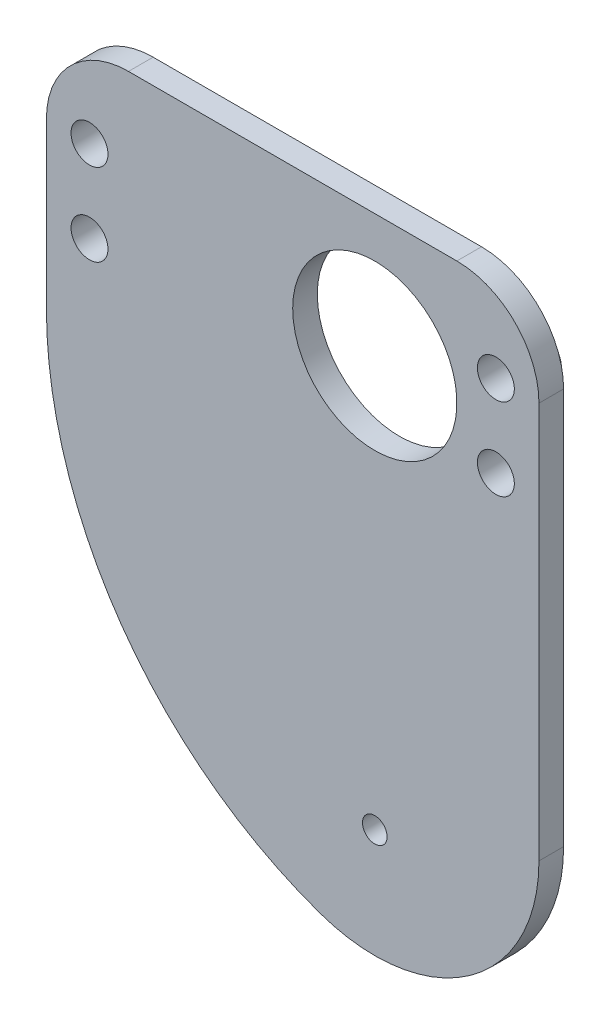
from build123d import *

# Parameters (mm, degrees)
SKETCH_3_R               = 3
EXTRUDE_6_DEPTH          = 2
EXTRUDE_6_2_DEPTH        = 2
EXTRUDE_6_3_DEPTH        = 2
EXTRUDE_6_4_DEPTH        = 2
CUT_EXTRUDE_2_DEPTH      = 10
CUT_EXTRUDE_2_DEPTH_BACK = 2
SKETCH_11_R              = 2.25
SKETCH_12_W              = 60
SKETCH_12_H              = 80
EXTRUDE_7_DEPTH          = 3
CUT_EXTRUDE_START        = -3
SKETCH_14_R              = 2.25
SKETCH_14_R_2            = 10
CUT_EXTRUDE_3_DEPTH      = 3
SKETCH_15_R              = 10
SKETCH_15_R_2            = 1.5
CUT_EXTRUDE_4_DEPTH      = 3
FILLET_2_R               = 50
FILLET_3_R               = 20
FILLET_4_R               = 10


with BuildPart() as part:
    # 草图3 → 凸台-拉伸6 (new body)
    with BuildSketch(Plane.XY):
        with Locations((60.266478541, 16.532501821)):
            Circle(SKETCH_3_R)
    extrude(amount=EXTRUDE_6_DEPTH)


with BuildPart() as body_2:
    # 草图3 → Extrude 6 2 (new body)
    with BuildSketch(Plane.XY):
        with Locations((60.266478541, 6.532501821)):
            Circle(SKETCH_3_R)
    extrude(amount=EXTRUDE_6_2_DEPTH)


with BuildPart() as body_3:
    # 草图3 → Extrude 6 3 (new body)
    with BuildSketch(Plane.XY):
        with Locations((10.766478541, 6.532501821)):
            Circle(SKETCH_3_R)
    extrude(amount=EXTRUDE_6_3_DEPTH)


with BuildPart() as body_4:
    # 草图3 → Extrude 6 4 (new body)
    with BuildSketch(Plane.XY):
        with Locations((10.766478541, 16.532501821)):
            Circle(SKETCH_3_R)
    extrude(amount=EXTRUDE_6_4_DEPTH)


with BuildPart() as cut_extrude_2_tool:
    # 草图11 → 切除-拉伸2 (new, two sides: drawn at the far end of the back side and taken through both)
    with BuildSketch(Plane.XY.offset(2).offset(-CUT_EXTRUDE_2_DEPTH_BACK)):
        with Locations((10.766478541, 16.532501821)):
            Circle(SKETCH_11_R)
        with Locations((10.766478541, 6.532501821)):
            Circle(SKETCH_11_R)
        with Locations((60.266478541, 16.532501821)):
            Circle(SKETCH_11_R)
        with Locations((60.266478541, 6.532501821)):
            Circle(SKETCH_11_R)
    extrude(amount=CUT_EXTRUDE_2_DEPTH + CUT_EXTRUDE_2_DEPTH_BACK)


with BuildPart() as part_1:
    add(part.part)

    # 切除-拉伸2: cut by cut_extrude_2_tool
    add(cut_extrude_2_tool.part, mode=Mode.SUBTRACT)



with BuildPart() as body_2_1:
    add(body_2.part)

    # 切除-拉伸2: cut by cut_extrude_2_tool
    add(cut_extrude_2_tool.part, mode=Mode.SUBTRACT)


with BuildPart() as body_3_1:
    add(body_3.part)

    # 切除-拉伸2: cut by cut_extrude_2_tool
    add(cut_extrude_2_tool.part, mode=Mode.SUBTRACT)


with BuildPart() as body_4_1:
    add(body_4.part)

    # 切除-拉伸2: cut by cut_extrude_2_tool
    add(cut_extrude_2_tool.part, mode=Mode.SUBTRACT)


with BuildPart() as part_2:
    add(part_1.part)

    add(body_2_1.part)  # 凸台-拉伸7 merges body 2

    add(body_3_1.part)  # 凸台-拉伸7 merges body 3

    add(body_4_1.part)  # 凸台-拉伸7 merges body 4
    # 草图12 → 凸台-拉伸7 (add)
    with BuildSketch(Plane.XY.offset(2)):
        with Locations((35.516478541, -13.467498179)):
            Rectangle(SKETCH_12_W, SKETCH_12_H)
    extrude(amount=EXTRUDE_7_DEPTH)

    # 草图14 → 切除-拉伸3 (cut)
    with BuildSketch(Plane(origin=(0, 0, 2), x_dir=(-1, 0, 0), z_dir=(0, 0, -1)).offset(CUT_EXTRUDE_START)):
        with Locations((-60.266478541, 6.532501821)):
            Circle(SKETCH_14_R)
        with Locations((-60.266478541, 16.532501821)):
            Circle(SKETCH_14_R)
        with Locations((-10.766478541, 6.532501821)):
            Circle(SKETCH_14_R)
        with Locations((-10.766478541, 16.532501821)):
            Circle(SKETCH_14_R)
        with Locations((-45.516478541, 11.532501821)):
            Circle(SKETCH_14_R_2)
    extrude(amount=CUT_EXTRUDE_3_DEPTH, mode=Mode.SUBTRACT)

    # 草图15 → 切除-拉伸4 (cut)
    with BuildSketch(Plane(origin=(0, 0, 2), x_dir=(-1, 0, 0), z_dir=(0, 0, -1)).offset(CUT_EXTRUDE_START)):
        with Locations((-45.516478541, 11.532501821)):
            Circle(SKETCH_15_R)
        with Locations((-45.516478541, -38.467498179)):
            Circle(SKETCH_15_R_2)
    extrude(amount=CUT_EXTRUDE_4_DEPTH, mode=Mode.SUBTRACT)

    # 圆角2
    fillet_2_edges = [part_2.edges().sort_by_distance(p)[0] for p in [
        (5.516478541, -53.467498179, 3.5),
    ]]
    fillet(fillet_2_edges, radius=FILLET_2_R)

    # 圆角3
    fillet_3_edges = [part_2.edges().sort_by_distance(p)[0] for p in [
        (65.516478541, -53.467498179, 3.5),
    ]]
    fillet(fillet_3_edges, radius=FILLET_3_R)

    # 圆角4
    fillet_4_edges = [part_2.edges().sort_by_distance(p)[0] for p in [
        (65.516478541, 26.532501821, 3.5),
        (5.516478541, 26.532501821, 3.5),
    ]]
    fillet(fillet_4_edges, radius=FILLET_4_R)


solid = part_2.part
